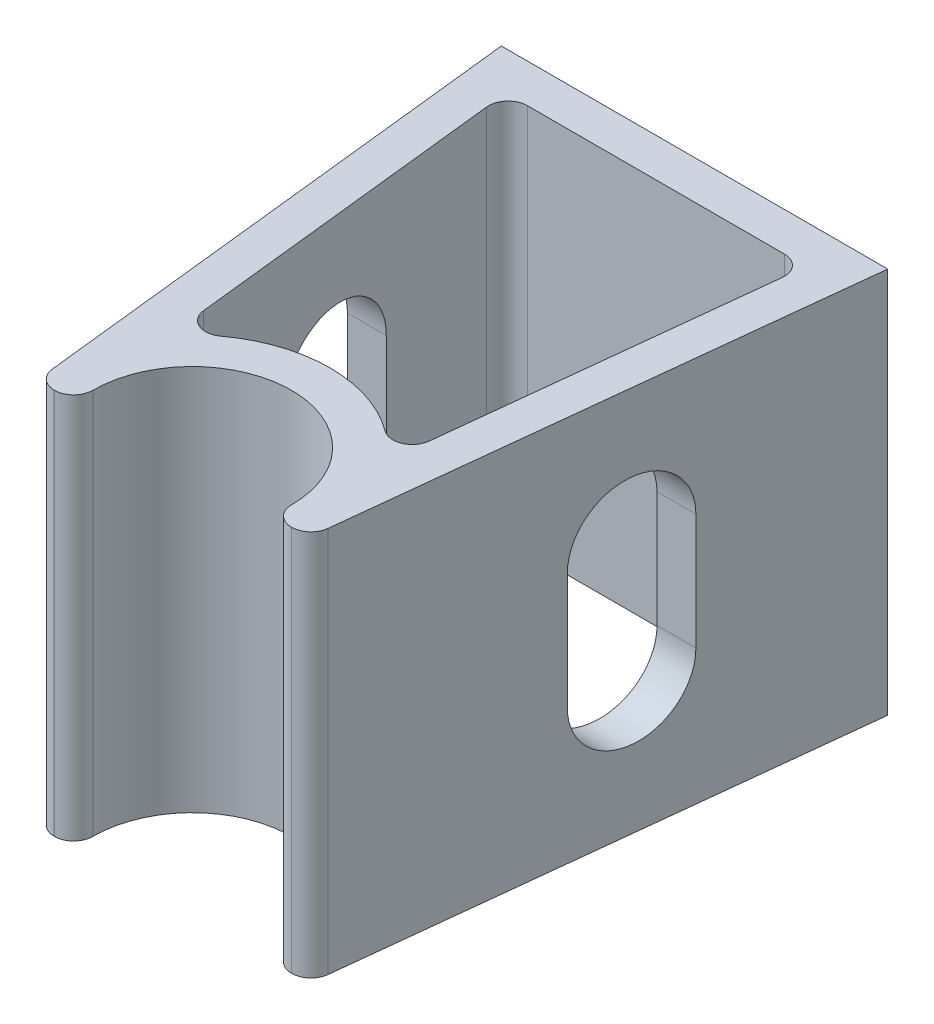
from build123d import *

# Parameters (mm, degrees)
BOSS_EXTRUDE1_DEPTH     = 50
CUT_EXTRUDE1_DEPTH      = 86.732140997
CUT_EXTRUDE1_DEPTH_BACK = 86.732140997
FILLET2_R               = 2.5
CUT_EXTRUDE2_DEPTH      = 86.732140997
CUT_EXTRUDE2_DEPTH_BACK = 86.732140997
SKETCH4_W               = 0.314102564
SKETCH4_H               = 2.557692308
BOSS_EXTRUDE2_DEPTH     = 1


with BuildPart() as part:
    # Sketch1 → Boss-Extrude1 (new body)
    with BuildSketch(Plane(origin=(0, 0, 0), x_dir=(1, 0, 0), z_dir=(0, 1, 0))):
        with BuildLine():
            Line((-12.6, -2.5), (-17.6, -2.5))
            Line((-17.6, -2.5), (-25, 65))
            Line((-25, 65), (25, 65))
            Line((25, 65), (17.6, -2.5))
            Line((17.6, -2.5), (12.6, -2.5))
            ThreePointArc((12.6, -2.5), (0, 12.845621822), (-12.6, -2.5))
        make_face()
    extrude(amount=BOSS_EXTRUDE1_DEPTH)

    # Sketch2 → Cut-Extrude1 (cut, two sides: drawn at the far end of the back side and taken through both)
    with BuildSketch(Plane(origin=(0, 50, 0), x_dir=(1, 0, 0), z_dir=(0, 1, 0)).offset(-CUT_EXTRUDE1_DEPTH_BACK)):
        with BuildLine():
            Line((14.050316299, 11.002491996), (19.421894954, 60))
            Line((19.421894954, 60), (-19.421894954, 60))
            Line((-19.421894954, 60), (-14.050316299, 11.002491996))
            ThreePointArc((-14.050316299, 11.002491996), (0, 17.845621822), (14.050316299, 11.002491996))
        make_face()
    extrude(amount=CUT_EXTRUDE1_DEPTH + CUT_EXTRUDE1_DEPTH_BACK, mode=Mode.SUBTRACT)

    # Fillet2
    fillet2_edges = [part.edges().sort_by_distance(p)[0] for p in [
        (-19.421894954, 25, -60),
        (19.421894954, 25, -60),
        (14.050316299, 25, -11.002491996),
        (-14.050316299, 25, -11.002491996),
        (17.6, 25, 2.5),
        (12.6, 25, 2.5),
        (-17.6, 25, 2.5),
        (-12.6, 25, 2.5),
    ]]
    fillet(fillet2_edges, radius=FILLET2_R)

    # Sketch3 → Cut-Extrude2 (cut, two sides: drawn at the far end of the back side and taken through both)
    with BuildSketch(Plane(origin=(0, 0, 0), x_dir=(0, 0, -1), z_dir=(1, 0, 0)).offset(-CUT_EXTRUDE2_DEPTH_BACK)):
        with BuildLine():
            Line((42.627558228, 32.5), (42.627558228, 17.5))
            ThreePointArc((42.627558228, 17.5), (35.127558228, 10), (27.627558228, 17.5))
            Line((27.627558228, 17.5), (27.627558228, 32.5))
            ThreePointArc((27.627558228, 32.5), (35.127558228, 40), (42.627558228, 32.5))
        make_face()
    extrude(amount=CUT_EXTRUDE2_DEPTH + CUT_EXTRUDE2_DEPTH_BACK, mode=Mode.SUBTRACT)

    # Sketch4 → Boss-Extrude2 (add)
    # profile 1 of 7: a face of its own
    with BuildSketch(Plane(origin=(0, 0, -65), x_dir=(-1, 0, 0), z_dir=(0, 0, -1))):
        with BuildLine():
            Line((-5.137688382, 22.117245436), (-4.823585817, 22.117245436))
            Line((-4.823585817, 22.117245436), (-4.823585817, 21.643988225))
            add(Edge.make_bspline(
                [(-4.823585817, 21.643988225), (-4.790228333, 21.686925958), (-4.725404739, 21.770366851), (-4.613679834, 21.87835698), (-4.495753025, 21.969432284), (-4.368589612, 22.040814817), (-4.234165922, 22.094635628), (-4.093033605, 22.134415078), (-3.94399484, 22.157856553), (-3.842098387, 22.160678214), (-3.790132292, 22.162117231)],
                knots=[0, 0, 0, 0, 1.0828784, 2.104357462, 3.088488658, 4.04616522, 5.001424249, 5.969181776, 6.964304535, 8, 8, 8, 8], degree=3))
            add(Edge.make_bspline(
                [(-3.790132292, 22.162117231), (-3.744740689, 22.160804052), (-3.6550218, 22.158208485), (-3.522958571, 22.14063543), (-3.395783188, 22.110517738), (-3.274215134, 22.067116823), (-3.156952069, 22.013461353), (-3.045729969, 21.945744317), (-2.938816413, 21.867338126), (-2.838900224, 21.777105976), (-2.746578857, 21.679477709), (-2.666732675, 21.574455405), (-2.597860771, 21.465492819), (-2.542190475, 21.350900726), (-2.498582127, 21.231581497), (-2.46756745, 21.107053056), (-2.449109806, 20.977777115), (-2.446633354, 20.889874395), (-2.445380689, 20.8454105)],
                knots=[0, 0, 0, 0, 1.041296284, 2.058176809, 3.050446431, 4.034000596, 5.01514041, 6.003636468, 7.015969324, 8.052561599, 9.08815499, 10.094063707, 11.074456064, 12.040834395, 13.011057502, 13.983766392, 14.980127149, 16, 16, 16, 16], degree=3))
            add(Edge.make_bspline(
                [(-2.445380689, 20.8454105), (-2.446606175, 20.800008192), (-2.449023009, 20.710468287), (-2.467768015, 20.57898119), (-2.497724889, 20.452493816), (-2.540783072, 20.331216553), (-2.596424561, 20.215232901), (-2.664129121, 20.104626505), (-2.744015588, 19.999432802), (-2.835316716, 19.901079902), (-2.934369652, 19.810480589), (-3.040247141, 19.731242519), (-3.151306067, 19.664701144), (-3.266978234, 19.609118185), (-3.388253873, 19.567226001), (-3.51456715, 19.5370082), (-3.645849297, 19.518373704), (-3.735150449, 19.515921562), (-3.780316587, 19.514681334)],
                knots=[0, 0, 0, 0, 1.038740735, 2.04854663, 3.033179607, 4.009277356, 4.987731542, 5.972001279, 6.972200261, 8.005528982, 9.039189865, 10.040446548, 11.026516639, 11.997840187, 12.972163198, 13.956796175, 14.96660207, 16, 16, 16, 16], degree=3))
            add(Edge.make_bspline(
                [(-3.780316587, 19.514681334), (-3.831144159, 19.515976141), (-3.931543515, 19.518533766), (-4.078341185, 19.544453176), (-4.219618037, 19.583190112), (-4.353808862, 19.639889105), (-4.481976674, 19.712144621), (-4.60339648, 19.800254827), (-4.718713233, 19.904035452), (-4.78812199, 19.982767268), (-4.823585817, 20.022994635)],
                knots=[0, 0, 0, 0, 1.014726462, 2.004382257, 2.969841629, 3.936926163, 4.907207904, 5.903978561, 6.929055279, 8, 8, 8, 8], degree=3))
            Line((-4.823585817, 20.022994635), (-4.823585817, 18.617245436))
            Line((-4.823585817, 18.617245436), (-5.137688382, 18.617245436))
            Line((-5.137688382, 18.617245436), (-5.137688382, 22.117245436))
        make_face()
        with BuildLine():
            add(Edge.make_bspline(
                [(-3.792936779, 21.848014667), (-3.828516341, 21.847374409), (-3.898563329, 21.846113905), (-4.001235548, 21.831139957), (-4.100130976, 21.809402215), (-4.194252927, 21.776490315), (-4.284503544, 21.736091502), (-4.370187709, 21.685609491), (-4.451245276, 21.625957485), (-4.527472307, 21.558278141), (-4.5963356, 21.483703453), (-4.657298528, 21.404115644), (-4.708505833, 21.319615504), (-4.751007853, 21.230990142), (-4.783351136, 21.137544856), (-4.806306856, 21.039811844), (-4.820737209, 20.937684131), (-4.822626146, 20.868128125), (-4.823585817, 20.832790308)],
                knots=[0, 0, 0, 0, 1.05670511, 2.080379991, 3.077984906, 4.06214886, 5.038337365, 6.01289324, 7.01187578, 8.025460281, 9.038092164, 10.024533457, 11.000252242, 11.969694649, 12.940728589, 13.933144304, 14.949937299, 16, 16, 16, 16], degree=3))
            add(Edge.make_bspline(
                [(-4.823585817, 20.832790308), (-4.821994961, 20.786402195), (-4.818878339, 20.695523954), (-4.793540971, 20.562739832), (-4.752305707, 20.437088177), (-4.693776994, 20.31962714), (-4.61982942, 20.211644305), (-4.530731263, 20.114953698), (-4.427288712, 20.030163107), (-4.31122152, 19.958741853), (-4.18679939, 19.900753787), (-4.057013478, 19.859239577), (-3.923648597, 19.833667348), (-3.833480277, 19.830420529), (-3.788028926, 19.828783898)],
                knots=[0, 0, 0, 0, 1.03728447, 2.032128127, 3.01272805, 3.987917167, 4.958271349, 5.931593992, 6.91984656, 7.941419022, 8.973179163, 9.983609215, 10.983593296, 12, 12, 12, 12], degree=3))
            add(Edge.make_bspline(
                [(-3.788028926, 19.828783898), (-3.743493158, 19.830340275), (-3.655097665, 19.833429403), (-3.524939544, 19.86016759), (-3.398448906, 19.901012615), (-3.278268733, 19.960572171), (-3.165445245, 20.03356223), (-3.063563692, 20.121122263), (-2.974556778, 20.222612206), (-2.898692423, 20.335620709), (-2.837560938, 20.456796092), (-2.791630698, 20.582177481), (-2.765122125, 20.711322904), (-2.761365336, 20.798320617), (-2.759483253, 20.841904891)],
                knots=[0, 0, 0, 0, 1.00104056, 1.986885549, 2.97790532, 3.984399681, 4.995088187, 5.994304198, 6.996462723, 8.023150851, 9.048424203, 10.043036403, 11.019596776, 12, 12, 12, 12], degree=3))
            add(Edge.make_bspline(
                [(-2.759483253, 20.841904891), (-2.760937987, 20.88575988), (-2.763836121, 20.973128184), (-2.792383159, 21.101891087), (-2.835283136, 21.227779063), (-2.897842188, 21.347299613), (-2.972043458, 21.460073696), (-3.061790455, 21.559627575), (-3.162406651, 21.646798247), (-3.275095815, 21.718813657), (-3.396036241, 21.776099152), (-3.523351157, 21.817982791), (-3.656394759, 21.84315654), (-3.747022413, 21.846381047), (-3.792936779, 21.848014667)],
                knots=[0, 0, 0, 0, 0.983928682, 1.960191568, 2.949917689, 3.96440592, 4.982380491, 5.975291189, 6.965713506, 7.964880129, 8.970154049, 9.96478489, 10.968906225, 12, 12, 12, 12], degree=3))
        make_face(mode=Mode.SUBTRACT)
    # profile 2 of 7: a face of its own
    with BuildSketch(Plane(origin=(0, 0, -65), x_dir=(-1, 0, 0), z_dir=(0, 0, -1))):
        with BuildLine():
            Line((-1.906919151, 22.117245436), (-1.592816587, 22.117245436))
            Line((-1.592816587, 22.117245436), (-1.592816587, 21.740743032))
            add(Edge.make_bspline(
                [(-1.592816587, 21.740743032), (-1.569627828, 21.775798861), (-1.525279507, 21.84284286), (-1.451566578, 21.931512161), (-1.376063246, 22.004927208), (-1.298408059, 22.063430726), (-1.218029959, 22.107243845), (-1.136693007, 22.13933688), (-1.053117538, 22.158314195), (-0.996955613, 22.160847854), (-0.968818189, 22.162117231)],
                knots=[0, 0, 0, 0, 1.2804753, 2.448899062, 3.506932113, 4.484331642, 5.4025378, 6.288909075, 7.142734305, 8, 8, 8, 8], degree=3))
            add(Edge.make_bspline(
                [(-0.968818189, 22.162117231), (-0.946991863, 22.160926704), (-0.902082778, 22.158477119), (-0.834100188, 22.141266294), (-0.764056736, 22.113788271), (-0.718914349, 22.087948049), (-0.695380689, 22.074477007)],
                knots=[0, 0, 0, 0, 0.901110191, 1.854092781, 2.881294221, 4, 4, 4, 4], degree=3))
            Line((-0.695380689, 22.074477007), (-0.867856651, 21.80244175))
            add(Edge.make_bspline(
                [(-0.867856651, 21.80244175), (-0.882965672, 21.809182016), (-0.911645486, 21.821976332), (-0.953600053, 21.837118342), (-0.992281389, 21.846034258), (-1.016924948, 21.847384975), (-1.028413542, 21.848014667)],
                knots=[0, 0, 0, 0, 1.180555205, 2.24091978, 3.179933427, 4, 4, 4, 4], degree=3))
            add(Edge.make_bspline(
                [(-1.028413542, 21.848014667), (-1.053619275, 21.84633463), (-1.105031665, 21.84290784), (-1.180516165, 21.815969033), (-1.25376337, 21.772443792), (-1.311935032, 21.724172681), (-1.356977285, 21.677624883), (-1.389117511, 21.636976481), (-1.418600258, 21.591397849), (-1.446770478, 21.541668165), (-1.472436772, 21.486938319), (-1.496391442, 21.427755106), (-1.518050305, 21.364049977), (-1.530400549, 21.319667457), (-1.536726843, 21.296932936)],
                knots=[0, 0, 0, 0, 1.125678352, 2.296057538, 3.5422874, 4.923748041, 5.663163013, 6.437101912, 7.23742474, 8.08941207, 8.991984279, 9.93940061, 10.944477711, 12, 12, 12, 12], degree=3))
            add(Edge.make_bspline(
                [(-1.536726843, 21.296932936), (-1.541459236, 21.276655763), (-1.551941128, 21.231743364), (-1.562132666, 21.156394839), (-1.572202184, 21.06737118), (-1.579298802, 20.964424588), (-1.585876844, 20.847812144), (-1.589586927, 20.717356198), (-1.592690067, 20.572922847), (-1.592773134, 20.471948494), (-1.592816587, 20.419128449)],
                knots=[0, 0, 0, 0, 0.566838948, 1.255505196, 2.06880316, 3.007127437, 4.065329342, 5.249902469, 6.561414163, 8, 8, 8, 8], degree=3))
            Line((-1.592816587, 20.419128449), (-1.592816587, 19.559553128))
            Line((-1.592816587, 19.559553128), (-1.906919151, 19.559553128))
            Line((-1.906919151, 19.559553128), (-1.906919151, 22.117245436))
        make_face()
    # profile 3 of 7: a face of its own
    with BuildSketch(Plane(origin=(0, 0, -65), x_dir=(-1, 0, 0), z_dir=(0, 0, -1))):
        with BuildLine():
            Line((2.221285977, 22.117245436), (2.221285977, 19.559553128))
            Line((2.221285977, 19.559553128), (1.907183413, 19.559553128))
            Line((1.907183413, 19.559553128), (1.907183413, 20.001960981))
            add(Edge.make_bspline(
                [(1.907183413, 20.001960981), (1.871764623, 19.961921387), (1.802644407, 19.883783616), (1.687203289, 19.781701443), (1.564835112, 19.697323122), (1.43613379, 19.629173206), (1.301215547, 19.57798115), (1.16037946, 19.541594991), (1.013568079, 19.518201156), (0.913315724, 19.515865134), (0.862511939, 19.514681334)],
                knots=[0, 0, 0, 0, 1.074387032, 2.096679803, 3.090159297, 4.057316773, 5.018401886, 5.985159533, 6.978961417, 8, 8, 8, 8], degree=3))
            add(Edge.make_bspline(
                [(0.862511939, 19.514681334), (0.817343985, 19.515907706), (0.72827078, 19.518326166), (0.597241703, 19.53708847), (0.471149454, 19.567219092), (0.349874881, 19.609119981), (0.234202736, 19.664700803), (0.123142639, 19.731242051), (0.017269947, 19.810482881), (-0.081801592, 19.901070909), (-0.173033592, 19.999465896), (-0.253094865, 20.104411443), (-0.319847945, 20.215453747), (-0.375668026, 20.331186901), (-0.41866437, 20.452501821), (-0.448638004, 20.578978988), (-0.467378451, 20.710468862), (-0.469795912, 20.800008385), (-0.471021715, 20.8454105)],
                knots=[0, 0, 0, 0, 1.033919861, 2.038935746, 3.024066025, 3.998881131, 4.97069526, 5.957263378, 6.95902576, 7.993208707, 9.027059324, 10.027763471, 11.009749337, 11.988697705, 12.965288445, 13.950418724, 14.960734635, 16, 16, 16, 16], degree=3))
            add(Edge.make_bspline(
                [(-0.471021715, 20.8454105), (-0.469768743, 20.889874204), (-0.467291687, 20.977776547), (-0.448838467, 21.107055245), (-0.417807458, 21.231573506), (-0.37425961, 21.350930449), (-0.318417655, 21.465270499), (-0.250489568, 21.574674524), (-0.170470444, 21.679443922), (-0.078218037, 21.777115149), (0.021716733, 21.867335763), (0.128625464, 21.945744808), (0.239848746, 22.013461657), (0.357111756, 22.067115133), (0.478678861, 22.110524238), (0.605632307, 22.140557206), (0.737443885, 22.158254527), (0.826934377, 22.160817291), (0.872327644, 22.162117231)],
                knots=[0, 0, 0, 0, 1.020392517, 2.01726096, 2.990465484, 3.961182959, 4.928053699, 5.906110375, 6.912531644, 7.948652711, 8.985773172, 9.998621852, 10.987621588, 11.969261332, 12.953316658, 13.946091881, 14.958173133, 16, 16, 16, 16], degree=3))
            add(Edge.make_bspline(
                [(0.872327644, 22.162117231), (0.924527503, 22.160679479), (1.026888963, 22.157860117), (1.176616972, 22.134397389), (1.31826145, 22.094758922), (1.452915802, 22.040841424), (1.580096488, 21.969192695), (1.698599473, 21.878812734), (1.809664956, 21.770271547), (1.874045248, 21.686901103), (1.907183413, 21.643988225)],
                knots=[0, 0, 0, 0, 1.038897134, 2.037228247, 3.008116434, 3.962042015, 4.918381754, 5.904844433, 6.921570401, 8, 8, 8, 8], degree=3))
            Line((1.907183413, 21.643988225), (1.907183413, 22.117245436))
            Line((1.907183413, 22.117245436), (2.221285977, 22.117245436))
        make_face()
        with BuildLine():
            add(Edge.make_bspline(
                [(0.876534375, 21.848014667), (0.830620037, 21.846381029), (0.739992437, 21.843156488), (0.606948435, 21.817982993), (0.479635021, 21.776098399), (0.358688947, 21.718816497), (0.24602073, 21.646787761), (0.145327059, 21.559666378), (0.055784358, 21.459829363), (-0.019523906, 21.347727253), (-0.080914403, 21.227549162), (-0.124081435, 21.101924724), (-0.152550683, 20.973119746), (-0.155459203, 20.88575706), (-0.156919151, 20.841904891)],
                knots=[0, 0, 0, 0, 1.031046209, 2.035121221, 3.029706178, 4.034933723, 5.034054252, 6.02443088, 7.017295772, 8.038157696, 9.050218397, 10.03989886, 11.016116709, 12, 12, 12, 12], degree=3))
            add(Edge.make_bspline(
                [(-0.156919151, 20.841904891), (-0.155054257, 20.798314784), (-0.151331781, 20.711305428), (-0.124581086, 20.582324851), (-0.079701213, 20.456670809), (-0.01845915, 20.335409816), (0.058227475, 20.222825716), (0.147116127, 20.121085593), (0.249066409, 20.033596005), (0.361993916, 19.960358431), (0.482601886, 19.90119591), (0.609435818, 19.860030271), (0.740111456, 19.83345249), (0.82896379, 19.830348013), (0.873729888, 19.828783898)],
                knots=[0, 0, 0, 0, 0.979072187, 1.954306742, 2.945804271, 3.96968567, 4.997920485, 5.998718438, 6.996577872, 8.005894225, 9.015743152, 10.005417472, 10.995077863, 12, 12, 12, 12], degree=3))
            add(Edge.make_bspline(
                [(0.873729888, 19.828783898), (0.91917639, 19.830443862), (1.009564977, 19.833745365), (1.143003685, 19.859026631), (1.272498648, 19.900795429), (1.396285876, 19.958694556), (1.511602007, 20.030451911), (1.615099885, 20.114459003), (1.702615853, 20.212162187), (1.776808463, 20.31953864), (1.834983879, 20.437250636), (1.877359939, 20.562584827), (1.902413844, 20.695545575), (1.905571574, 20.786409502), (1.907183413, 20.832790308)],
                knots=[0, 0, 0, 0, 1.01762866, 2.023962475, 3.030623092, 4.058876274, 5.077231937, 6.066672613, 7.034107872, 8.005628644, 8.981990164, 9.965428785, 10.961468474, 12, 12, 12, 12], degree=3))
            add(Edge.make_bspline(
                [(1.907183413, 20.832790308), (1.906223757, 20.868128138), (1.90433485, 20.937684172), (1.88990428, 21.039811689), (1.866949354, 21.137545415), (1.834603184, 21.230988104), (1.792111899, 21.31962312), (1.740864133, 21.40408688), (1.679958684, 21.483940091), (1.610375987, 21.558083162), (1.534210785, 21.625709625), (1.453616244, 21.686073865), (1.367637497, 21.735662638), (1.27772046, 21.77670391), (1.183709126, 21.80936306), (1.084838506, 21.831150753), (0.982159519, 21.846111074), (0.912113464, 21.847373455), (0.876534375, 21.848014667)],
                knots=[0, 0, 0, 0, 1.050140795, 2.067009409, 3.05949893, 4.030605086, 5.00011959, 5.97591094, 6.962425594, 7.979863591, 8.993523472, 9.986985069, 10.967611495, 11.937549037, 12.921786183, 13.919465291, 14.943216303, 16, 16, 16, 16], degree=3))
        make_face(mode=Mode.SUBTRACT)
    # profile 4 of 7: a face of its own
    with BuildSketch(Plane(origin=(0, 0, -65), x_dir=(-1, 0, 0), z_dir=(0, 0, -1))):
        Polygon((3.25333726, 23.149296718), (3.567439824, 23.149296718), (3.567439824, 22.117245436), (4.016157772, 22.117245436), (4.016157772, 21.803142872), (3.567439824, 21.803142872), (3.567439824, 19.559553128), (3.25333726, 19.559553128), (3.25333726, 21.803142872), (2.804619311, 21.803142872), (2.804619311, 22.117245436), (3.25333726, 22.117245436), align=None)
    # profile 5 of 7: a face of its own
    with BuildSketch(Plane(origin=(0, 0, -65), x_dir=(-1, 0, 0), z_dir=(0, 0, -1))):
        with BuildLine():
            add(Edge.make_bspline(
                [(4.665396554, 23.194168513), (4.68488787, 23.193264361), (4.72305561, 23.191493857), (4.778248878, 23.17633238), (4.82850589, 23.150632694), (4.873083623, 23.116153013), (4.911335509, 23.07560357), (4.93811622, 23.028342601), (4.955328616, 22.977283963), (4.957407171, 22.941668873), (4.958465465, 22.9235355)],
                knots=[0, 0, 0, 0, 1.055194115, 2.066272739, 3.074728998, 4.095836921, 5.109056067, 6.073838105, 7.019297344, 8, 8, 8, 8], degree=3))
            add(Edge.make_bspline(
                [(4.958465465, 22.9235355), (4.957383305, 22.905872847), (4.955244003, 22.870955872), (4.938129515, 22.8207824), (4.911107277, 22.774178117), (4.873108151, 22.733707406), (4.82849939, 22.699246786), (4.778250604, 22.673542047), (4.723055156, 22.65838191), (4.684887717, 22.656611221), (4.665396554, 22.655706975)],
                knots=[0, 0, 0, 0, 0.96129708, 1.900370562, 2.859976407, 3.87933698, 4.906634145, 5.921202961, 6.938410037, 8, 8, 8, 8], degree=3))
            add(Edge.make_bspline(
                [(4.665396554, 22.655706975), (4.646128279, 22.656576695), (4.608625099, 22.658269492), (4.554258257, 22.673839509), (4.504429767, 22.699255582), (4.459765095, 22.733481768), (4.422534902, 22.774426665), (4.395436576, 22.820753959), (4.378361614, 22.870963113), (4.376216986, 22.90587528), (4.375132131, 22.9235355)],
                knots=[0, 0, 0, 0, 1.054934014, 2.053291228, 3.073705704, 4.106921865, 5.123545215, 6.088680038, 7.033164197, 8, 8, 8, 8], degree=3))
            add(Edge.make_bspline(
                [(4.375132131, 22.9235355), (4.376193218, 22.94166635), (4.378277259, 22.977276482), (4.395449375, 23.028371515), (4.422309183, 23.075353017), (4.459789746, 23.116378517), (4.504423207, 23.150623951), (4.554259952, 23.176034933), (4.608624651, 23.191606272), (4.646128127, 23.193298887), (4.665396554, 23.194168513)],
                knots=[0, 0, 0, 0, 0.98631895, 1.937192651, 2.907499808, 3.917963147, 4.944918757, 5.95915025, 6.951458133, 8, 8, 8, 8], degree=3))
        make_face()
    # profile 6 of 7: a face of its own
    with BuildSketch(Plane(origin=(0, 0, -65), x_dir=(-1, 0, 0), z_dir=(0, 0, -1))):
        with Locations((4.666798798, 20.838399282)):
            Rectangle(SKETCH4_W, SKETCH4_H)
    # profile 7 of 7: a face of its own
    with BuildSketch(Plane(origin=(0, 0, -65), x_dir=(-1, 0, 0), z_dir=(0, 0, -1))):
        Polygon((5.586670593, 23.149296718), (5.900773157, 23.149296718), (5.900773157, 21.073976205), (7.065336458, 22.117245436), (7.516157772, 22.117245436), (6.165797195, 20.905706975), (7.650773157, 19.559553128), (7.199951843, 19.559553128), (5.900773157, 20.738138866), (5.900773157, 19.559553128), (5.586670593, 19.559553128), align=None)
    extrude(amount=BOSS_EXTRUDE2_DEPTH)


solid = part.part
